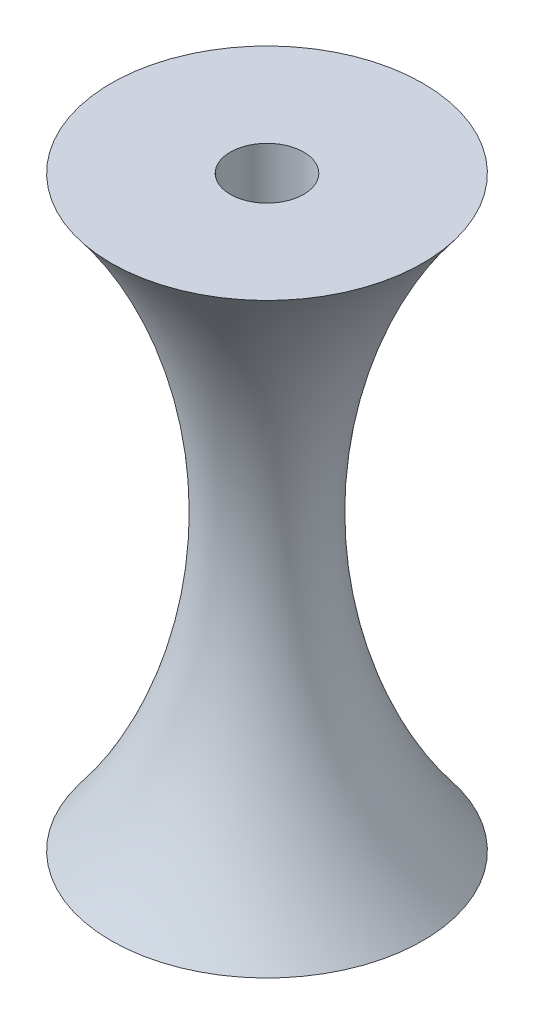
from build123d import *

# Parameters (mm, degrees)
SKETCH1_W          = 3
SKETCH1_H          = 32
SKETCH2_R          = 2
CUT_EXTRUDE1_DEPTH = 35.18332927
CUT_EXTRUDE2_START = -4
SKETCH3_R          = 2.5
CUT_EXTRUDE2_DEPTH = 24
FILLET1_R          = 0.5


with BuildPart() as part:
    # Sketch1 → Revolve1 (revolve)
    with BuildSketch(Plane.XY, mode=Mode.PRIVATE) as revolve1_sk:
        with BuildLine():
            Line((-3, -7e-08), (-3, 16))
            Line((-3, 16), (-8.5, 16))
            ThreePointArc((-8.5, 16), (-4.413382802, 8.459462125), (-3, -7e-08))
        make_face()
        with Locations((-1.5, 0)):
            Rectangle(SKETCH1_W, SKETCH1_H)
        with BuildLine():
            Line((-8.5, -16), (-3, -16))
            Line((-3, -16), (-3, -7e-08))
            ThreePointArc((-3, -7e-08), (-4.413382825, -8.459462191), (-8.5, -16))
        make_face()
    revolve(revolve1_sk.sketch.rotate(Axis((0, 16, 0), (0, -1, 0)), 270), axis=Axis((0, 16, 0), (0, -1, 0)))

    # Sketch2 → Cut-Extrude1 (cut, through all)
    with BuildSketch(Plane(origin=(0, 16, 0), x_dir=(1, 0, 0), z_dir=(0, 1, 0))):
        with Locations(Location((0, 0, 0), (0, 0, 270))):
            Circle(SKETCH2_R)
    extrude(amount=-CUT_EXTRUDE1_DEPTH, mode=Mode.SUBTRACT)

    # Sketch3 → Cut-Extrude2 (cut)
    with BuildSketch(Plane(origin=(0, 16, 0), x_dir=(1, 0, 0), z_dir=(0, 1, 0)).offset(CUT_EXTRUDE2_START)):
        with Locations(Location((0, 0, 0), (0, 0, 270))):
            Circle(SKETCH3_R)
    extrude(amount=-CUT_EXTRUDE2_DEPTH, mode=Mode.SUBTRACT)

    # Fillet1
    fillet1_edges = [part.edges().sort_by_distance(p)[0] for p in [
        (0, 12, -2.5),
        (0, -12, -2.5),
    ]]
    fillet(fillet1_edges, radius=FILLET1_R - 0.0001)  # a hair under: the kernel refuses the full size


solid = part.part
